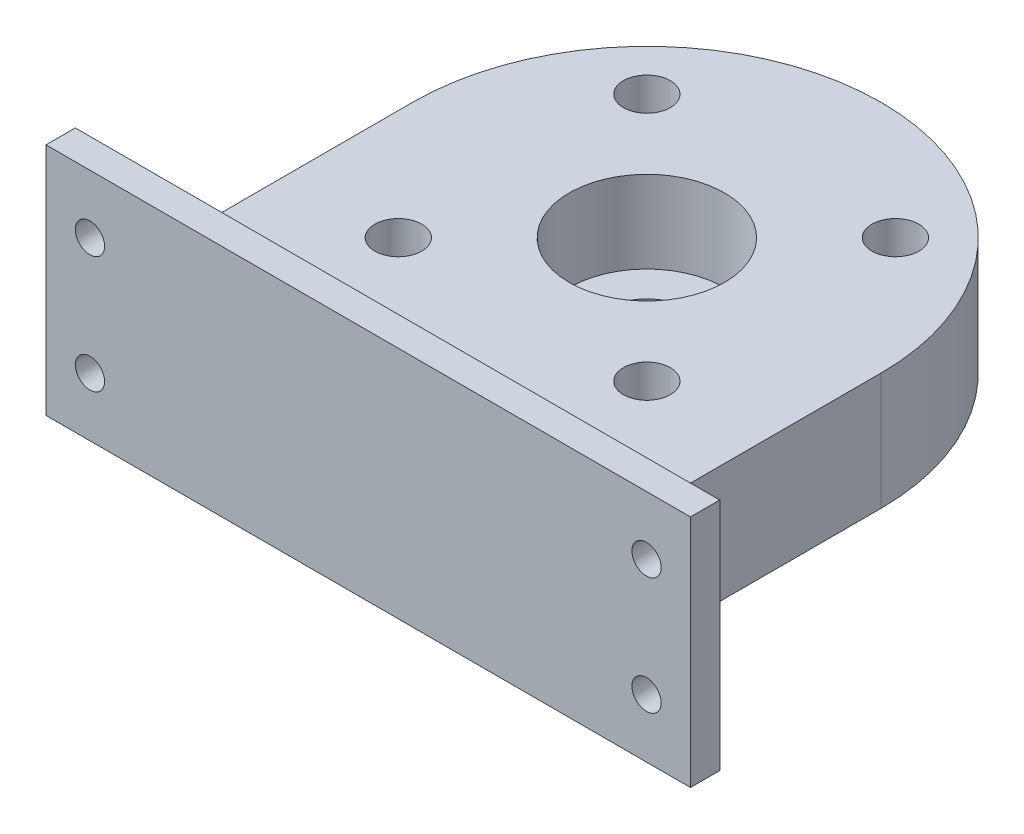
from build123d import *
from build123d.topology import SkipClean

# Parameters (mm, degrees)
SKETCH1_R           = 7
BOSS_EXTRUDE1_DEPTH = 20
SKETCH2_R           = 13.25
CUT_EXTRUDE1_DEPTH  = 14
SKETCH3_R           = 4
CUT_EXTRUDE2_DEPTH  = 76.40989747
SKETCH4_W           = 110
SKETCH4_H           = 5
BOSS_EXTRUDE2_DEPTH = 10
SKETCH5_W           = 110
SKETCH5_H           = 5
BOSS_EXTRUDE3_DEPTH = 10
FILLET1_START       = -40
FILLET1_DEPTH       = 80
FILLET1_START_2     = -10.0000001
FILLET1_2_DEPTH     = 40.0000001
FILLET1_START_3     = -55.0000001
FILLET1_3_DEPTH     = 110.0000002
SKETCH6_R           = 2.5
CUT_EXTRUDE4_DEPTH  = 108.662433145
SKETCH8_R           = 40
CUT_EXTRUDE5_DEPTH  = 79.655277385


with BuildPart() as part:
    # Sketch1 → Boss-Extrude1 (new body)
    with BuildSketch(Plane(origin=(0, 0, 0), x_dir=(1, 0, 0), z_dir=(0, 1, 0))):
        with BuildLine():
            Line((-55, -42.556835854), (-40, -42.556835854))
            Line((-40, -42.556835854), (-40, 0))
            ThreePointArc((-40, 0), (0, 40), (40, 0))
            Line((40, 0), (40, -42.556835854))
            Line((40, -42.556835854), (55, -42.556835854))
            Line((55, -42.556835854), (55, -47.556835854))
            Line((55, -47.556835854), (-55, -47.556835854))
            Line((-55, -47.556835854), (-55, -42.556835854))
        make_face()
        with Locations(Location((0, 0, 0), (0, 0, 270))):
            Circle(SKETCH1_R, mode=Mode.SUBTRACT)
    extrude(amount=BOSS_EXTRUDE1_DEPTH)

    # Sketch2 → Cut-Extrude1 (cut)
    with BuildSketch(Plane(origin=(0, 20, 0), x_dir=(1, 0, 0), z_dir=(0, 1, 0))):
        with Locations(Location((0, 0, 0), (0, 0, 270))):
            Circle(SKETCH2_R)
    extrude(amount=-CUT_EXTRUDE1_DEPTH, mode=Mode.SUBTRACT)

    # Sketch3 → Cut-Extrude2 (cut, through all)
    with BuildSketch(Plane(origin=(0, 20, 0), x_dir=(1, 0, 0), z_dir=(0, 1, 0))):
        with Locations(Location((-21.213203436, 21.213203436, 0), (0, 0, 270))):
            Circle(SKETCH3_R)
        with Locations(Location((21.213203436, 21.213203436, 0), (0, 0, 270))):
            Circle(SKETCH3_R)
        with Locations(Location((21.213203436, -21.213203436, 0), (0, 0, 270))):
            Circle(SKETCH3_R)
        with Locations(Location((-21.213203436, -21.213203436, 0), (0, 0, 270))):
            Circle(SKETCH3_R)
    extrude(amount=-CUT_EXTRUDE2_DEPTH, mode=Mode.SUBTRACT)

    # Sketch4 → Boss-Extrude2 (add)
    with BuildSketch(Plane.XZ):
        with Locations((0, 45.056835854)):
            Rectangle(SKETCH4_W, SKETCH4_H)
    extrude(amount=BOSS_EXTRUDE2_DEPTH)

    # Sketch5 → Boss-Extrude3 (add)
    with BuildSketch(Plane(origin=(0, 20, 0), x_dir=(1, 0, 0), z_dir=(0, 1, 0))):
        with Locations((0, -45.056835854)):
            Rectangle(SKETCH5_W, SKETCH5_H)
    extrude(amount=BOSS_EXTRUDE3_DEPTH)

    # Fillet1: read off the stored shape, not the designer's step
    # Fillet1 outline → Fillet1 (add)
    with BuildSketch(Plane.YZ.offset(FILLET1_START)):
        with BuildLine():
            Line((0, 42.556835854), (-10, 42.556835854))
            add(Edge.make_bspline(
                [(-10, 42.556835854), (0, 42.556835854), (0, 32.556835854)],
                knots=[0, 0, 0, 1, 1, 1], degree=2, weights=[1, 0.707106781, 1]))
            Line((0, 32.556835854), (0, 42.556835854))
        make_face()
        with BuildLine():
            Line((30, 42.556835854), (20, 42.556835854))
            Line((20, 42.556835854), (20, 32.556835854))
            add(Edge.make_bspline(
                [(30, 42.556835854), (20, 42.556835854), (20, 32.556835854)],
                knots=[0, 0, 0, 1, 1, 1], degree=2, weights=[1, 0.707106781, 1]))
        make_face()
    extrude(amount=FILLET1_DEPTH)

    # Fillet1 2 outline → Fillet1 2 (add)
    with SkipClean():  # the faces are left unmerged after this step: merging them gives an invalid solid
        with BuildSketch(Plane(origin=(0, 0, 0), x_dir=(1, 0, 0), z_dir=(0, 1, 0)).offset(FILLET1_START_2)):
            with BuildLine():
                add(Edge.make_bspline(
                    [(40, -32.556835854), (40, -42.556835854), (50, -42.556835854)],
                    knots=[0, 0, 0, 1, 1, 1], degree=2, weights=[1, 0.707106781, 1]))
                Line((40, -32.556835854), (40, -42.556835854))
                Line((40, -42.556835854), (50, -42.556835854))
            make_face()
            with BuildLine():
                add(Edge.make_bspline(
                    [(-50, -42.556835854), (-40, -42.556835854), (-40, -32.556835854)],
                    knots=[0, 0, 0, 1, 1, 1], degree=2, weights=[1, 0.707106781, 1]))
                Line((-50, -42.556835854), (-40, -42.556835854))
                Line((-40, -42.556835854), (-40, -32.556835854))
            make_face()
        extrude(amount=FILLET1_2_DEPTH)

    # Fillet1 3 outline → Fillet1 3 (cut)
    with BuildSketch(Plane.YZ.offset(FILLET1_START_3)):
        with BuildLine():
            Line((-10, 42.556835854), (-10.0000001, 32.556835854))
            Line((-10.0000001, 32.556835854), (0, 32.556835854))
            add(Edge.make_bspline(
                [(-10, 42.556835854), (0, 42.556835854), (0, 32.556835854)],
                knots=[0, 0, 0, 1, 1, 1], degree=2, weights=[1, 0.707106781, 1]))
        make_face()
        with BuildLine():
            add(Edge.make_bspline(
                [(30, 42.556835854), (20, 42.556835854), (20, 32.556835854)],
                knots=[0, 0, 0, 1, 1, 1], degree=2, weights=[1, 0.707106781, 1]))
            Line((20, 32.556835854), (30, 32.556835854))
            Line((30, 32.556835854), (30, 42.556835854))
        make_face()
    extrude(amount=FILLET1_3_DEPTH, mode=Mode.SUBTRACT)

    # Sketch6 → Cut-Extrude4 (cut, through all)
    with BuildSketch(Plane.XY.offset(47.556835854)):
        with Locations((-47.5, 20)):
            Circle(SKETCH6_R)
        with Locations(Location((-47.5, 0, 0), (0, 0, 180))):
            Circle(SKETCH6_R)
        with Locations((47.5, 0)):
            Circle(SKETCH6_R)
        with Locations((47.5, 20)):
            Circle(SKETCH6_R)
    extrude(amount=-CUT_EXTRUDE4_DEPTH, mode=Mode.SUBTRACT)

    # Sketch8 → Cut-Extrude5 (cut, through all)
    with BuildSketch(Plane(origin=(0, 20, 0), x_dir=(1, 0, 0), z_dir=(0, 1, 0))):
        Circle(SKETCH8_R)
    extrude(amount=CUT_EXTRUDE5_DEPTH, mode=Mode.SUBTRACT)


solid = part.part
